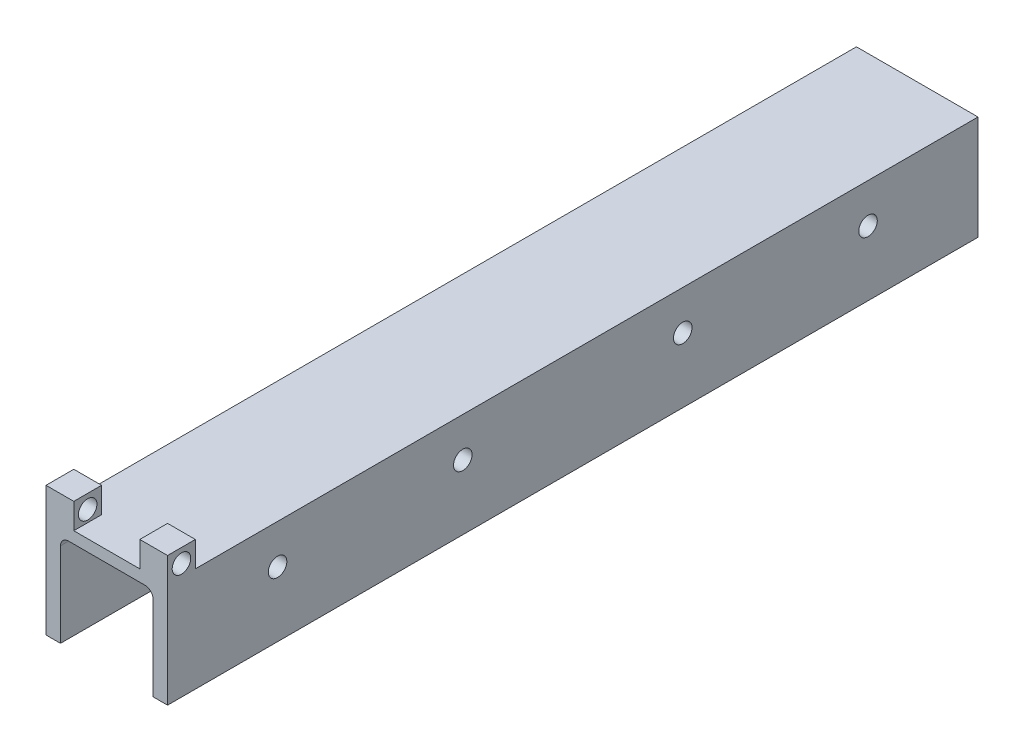
from build123d import *

# Parameters (mm, degrees)
BOSS_EXTRUDE2_DEPTH     = 177.8
SKETCH19_R              = 2.032
CUT_EXTRUDE3_DEPTH      = 182.236609161
SKETCH21_W              = 6.096
SKETCH21_H              = 6.096
BOSS_EXTRUDE4_DEPTH     = 5.588
CUT_EXTRUDE4_DEPTH      = 182.233049359
CUT_EXTRUDE4_DEPTH_BACK = 182.233049359
SKETCH22_R              = 2.032


with BuildPart() as part:
    # Sketch2 → Boss-Extrude2 (new body)
    with BuildSketch(Plane.XY):
        with BuildLine():
            Line((0, 0), (0, 22.86))
            Line((0, 22.86), (26.67, 22.86))
            Line((26.67, 22.86), (26.67, 0))
            Line((26.67, 0), (23.495, 0))
            Line((23.495, 0), (23.495, 18.542))
            ThreePointArc((23.495, 18.542), (22.974235857, 19.799235857), (21.717, 20.32))
            Line((21.717, 20.32), (4.953, 20.32))
            ThreePointArc((4.953, 20.32), (3.695764143, 19.799235857), (3.175, 18.542))
            Line((3.175, 18.542), (3.175, 0))
            Line((3.175, 0), (0, 0))
        make_face()
    extrude(amount=-BOSS_EXTRUDE2_DEPTH)

    # Sketch19 → Cut-Extrude3 (cut, through all)
    with BuildSketch(Plane(origin=(0, 0, 0), x_dir=(0, 0, -1), z_dir=(1, 0, 0))):
        with Locations((24.13, 14.224)):
            Circle(SKETCH19_R)
        with Locations((64.77, 14.224)):
            Circle(SKETCH19_R)
        with Locations((113.03, 14.224)):
            Circle(SKETCH19_R)
        with Locations((153.67, 14.224)):
            Circle(SKETCH19_R)
    extrude(amount=CUT_EXTRUDE3_DEPTH, mode=Mode.SUBTRACT)

    # Sketch21 → Boss-Extrude4 (add)
    with BuildSketch(Plane(origin=(0, 22.86, 0), x_dir=(1, 0, 0), z_dir=(0, 1, 0))):
        with Locations((3.048, 3.048)):
            Rectangle(SKETCH21_W, SKETCH21_H)
        with Locations((23.622, 3.048)):
            Rectangle(SKETCH21_W, SKETCH21_H)
    extrude(amount=BOSS_EXTRUDE4_DEPTH)

    # Sketch22 → Cut-Extrude4 (cut, two sides: drawn at the far end of the back side and taken through both)
    with BuildSketch(Plane.ZY.offset(-20.574).offset(-CUT_EXTRUDE4_DEPTH_BACK)):
        with Locations((-3.048, 25.4)):
            Circle(SKETCH22_R)
    extrude(amount=CUT_EXTRUDE4_DEPTH + CUT_EXTRUDE4_DEPTH_BACK, mode=Mode.SUBTRACT)


solid = part.part
